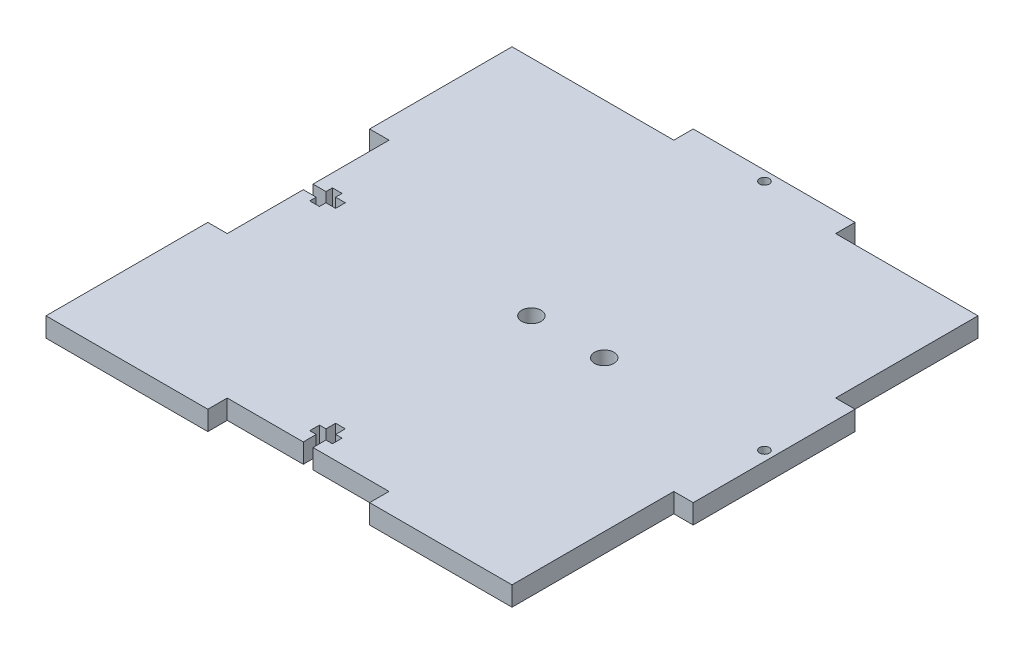
from build123d import *

# Parameters (mm, degrees)
SKETCH1_R           = 3
SKETCH1_R_2         = 1.5
BOSS_EXTRUDE1_DEPTH = 6


with BuildPart() as part:
    # Sketch1 → Boss-Extrude1 (new body)
    with BuildSketch(Plane(origin=(0, 0, 0), x_dir=(1, 0, 0), z_dir=(0, 1, 0))):
        Polygon((-72, 72), (-72, 28), (-66, 28), (-66, 4.5), (-62, 4.5), (-62, 6.5), (-59, 6.5), (-59, 4.5), (-56, 4.5), (-56, 1.5), (-59, 1.5), (-59, -0.5), (-62, -0.5), (-62, 1.5), (-66, 1.5), (-66, -22), (-72, -22), (-72, -72), (-22, -72), (-22, -66), (1.5, -66), (1.5, -62), (-0.5, -62), (-0.5, -59), (1.5, -59), (1.5, -56), (4.5, -56), (4.5, -59), (6.5, -59), (6.5, -62), (4.5, -62), (4.5, -66), (28, -66), (28, -72), (72, -72), (72, -22), (78, -22), (78, 28), (72, 28), (72, 72), (28, 72), (28, 78), (-22, 78), (-22, 72), align=None)
        with Locations((3, 3)):
            Circle(SKETCH1_R, mode=Mode.SUBTRACT)
        with Locations((25.5, 3)):
            Circle(SKETCH1_R, mode=Mode.SUBTRACT)
        with Locations((3, 75)):
            Circle(SKETCH1_R_2, mode=Mode.SUBTRACT)
        with Locations((75, 3)):
            Circle(SKETCH1_R_2, mode=Mode.SUBTRACT)
    extrude(amount=BOSS_EXTRUDE1_DEPTH)


solid = part.part
